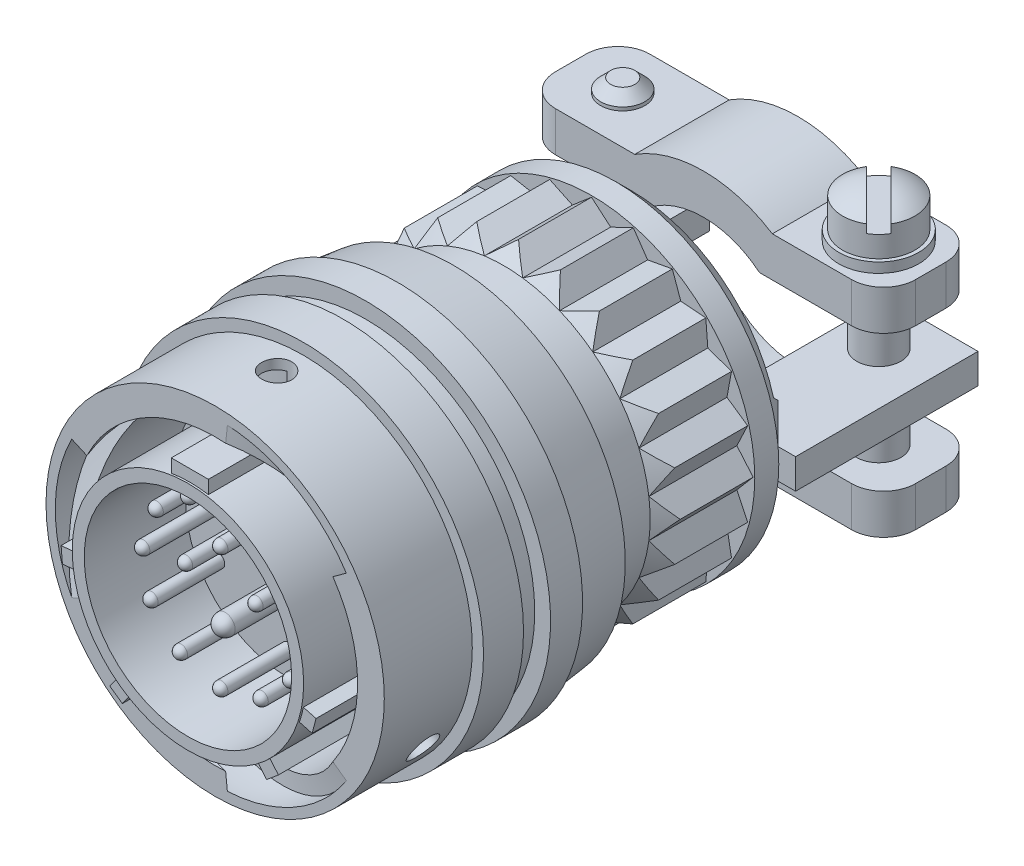
from build123d import *

# Parameters (mm, degrees)
SKETCH3_W                = 13.2842
SKETCH3_H                = 8.1407
BOSS_EXTRUDE1_START      = -9.2202
BOSS_EXTRUDE1_DEPTH      = 9.0678
SKETCH6_R                = 1.1938
CUT_EXTRUDE1_DEPTH       = 31.994286903
CUT_SWEEP1_PITCH         = 19.5072
CIRPATTERN1_COUNT        = 3
BOSS_EXTRUDE2_DEPTH      = 6.985
CIRPATTERN2_COUNT        = 24
BOSS_EXTRUDE3_DEPTH      = 13.208
BOSS_EXTRUDE3_DEPTH_BACK = 1.27
SKETCH12_W               = 7.2771
SKETCH12_H               = 2.3749
CHAMFER1_SIZE            = 1.905
CUT_EXTRUDE2_DEPTH       = 1.18745
CUT_EXTRUDE2_DEPTH_BACK  = 1.18745
SKETCH13_R               = 1.7526
BOSS_EXTRUDE4_DEPTH      = 7.493
SKETCH15_R               = 1.7526
CUT_EXTRUDE3_DEPTH       = 53.676709752
SKETCH16_W               = 1.2954
SKETCH16_H               = 0.7874
CUT_EXTRUDE4_START       = -1.6764
CUT_EXTRUDE4_DEPTH       = 55.345868243
CIRPATTERN3_COUNT        = 2
SKETCH14_15P_R           = 0.508
SKETCH14_15P_R_2         = 0.79375
BOSS_EXTRUDE14_15P_DEPTH = 5.7912
FILLET14_15P_20_R        = 0.508
FILLET14_15P_16_R        = 0.79375


with BuildPart() as part:
    # Sketch3 → Revolve1 (revolve)
    with BuildSketch(Plane(origin=(0, 0, 0), x_dir=(0, 0, -1), z_dir=(1, 0, 0)), mode=Mode.PRIVATE) as revolve1_sk:
        Polygon((9.7282, 10.2235), (9.7282, 9.525), (13.8684, 9.525), (14.66215, 10.31875), (20.44065, 10.31875), (21.2344, 9.525), (23.0124, 9.525), (23.0124, 9.3726), (21.2344, 9.3726), (21.2344, 8.2296), (0, 8.2296), (0, 9.1821), (9.2202, 9.1821), (9.2202, 10.2235), align=None)
        with Locations((14.5923, 4.07035)):
            Rectangle(SKETCH3_W, SKETCH3_H)
    revolve(revolve1_sk.sketch.rotate(Axis((0, 0, 0), (0, 0, -1)), 90), axis=Axis((0, 0, 0), (0, 0, -1)))

    # Sketch4 → Boss-Extrude1 (add)
    with BuildSketch(Plane.XY.offset(BOSS_EXTRUDE1_START)):
        with BuildLine():
            Line((-1.4732, 10.116799593), (1.4732, 10.116799593))
            Line((1.4732, 10.116799593), (1.4732, 9.063147476))
            ThreePointArc((1.4732, 9.063147476), (0, 9.1821), (-1.4732, 9.063147476))
            Line((-1.4732, 9.063147476), (-1.4732, 10.116799593))
        make_face()
        with BuildLine():
            Line((10.015348011, -2.052500052), (9.699795831, -3.230156819))
            Line((9.699795831, -3.230156819), (8.691883684, -2.960087573))
            ThreePointArc((8.691883684, -2.960087573), (8.86922753, -2.376502354), (9.007435863, -1.782430806))
            Line((9.007435863, -1.782430806), (10.015348011, -2.052500052))
        make_face()
        with BuildLine():
            Line((7.026827132, -7.425877235), (6.092865747, -8.209563888))
            Line((6.092865747, -8.209563888), (5.422137807, -7.410221455))
            ThreePointArc((5.422137807, -7.410221455), (5.902140111, -7.033896681), (6.356099192, -6.626534802))
            Line((6.356099192, -6.626534802), (7.026827132, -7.425877235))
        make_face()
        with BuildLine():
            Line((-5.354169915, -8.709352259), (-6.352880088, -8.010047868))
            Line((-6.352880088, -8.010047868), (-5.754371753, -7.155289382))
            ThreePointArc((-5.754371753, -7.155289382), (-5.266636196, -7.521535986), (-4.75566158, -7.854593773))
            Line((-4.75566158, -7.854593773), (-5.354169915, -8.709352259))
        make_face()
        with BuildLine():
            Line((-10.113344983, -1.496731609), (-10.219605264, -0.282171033))
            Line((-10.219605264, -0.282171033), (-9.180108534, -0.191226854))
            ThreePointArc((-9.180108534, -0.191226854), (-9.147159337, -0.800272745), (-9.073848253, -1.40578743))
            Line((-9.073848253, -1.40578743), (-10.113344983, -1.496731609))
        make_face()
    extrude(amount=BOSS_EXTRUDE1_DEPTH)

    # Sketch14-15P → Boss-Extrude14-15P (add)
    with BuildSketch(Plane.XY.offset(-7.9502)):
        with Locations(Location((2.54, 5.715, 0), (0, 0, 180))):
            Circle(SKETCH14_15P_R)
        with Locations(Location((5.1308, 3.556, 0), (0, 0, 180))):
            Circle(SKETCH14_15P_R)
        with Locations(Location((6.1976, 0.3556, 0), (0, 0, 180))):
            Circle(SKETCH14_15P_R)
        with Locations(Location((5.5372, -2.8702, 0), (0, 0, 180))):
            Circle(SKETCH14_15P_R)
        with Locations(Location((3.2004, -5.3086, 0), (0, 0, 180))):
            Circle(SKETCH14_15P_R)
        with Locations(Location((0, -6.223, 0), (0, 0, 180))):
            Circle(SKETCH14_15P_R)
        with Locations(Location((-3.2004, -5.3086, 0), (0, 0, 180))):
            Circle(SKETCH14_15P_R)
        with Locations(Location((-5.5372, -2.8702, 0), (0, 0, 180))):
            Circle(SKETCH14_15P_R)
        with Locations(Location((-6.1976, 0.3556, 0), (0, 0, 180))):
            Circle(SKETCH14_15P_R)
        with Locations(Location((-5.1308, 3.556, 0), (0, 0, 180))):
            Circle(SKETCH14_15P_R)
        with Locations(Location((-2.54, 5.715, 0), (0, 0, 180))):
            Circle(SKETCH14_15P_R)
        with Locations(Location((0, 3.556, 0), (0, 0, 180))):
            Circle(SKETCH14_15P_R)
        with Locations(Location((2.794, 1.016, 0), (0, 0, 180))):
            Circle(SKETCH14_15P_R)
        with Locations(Location((0, -1.9558, 0), (0, 0, 180))):
            Circle(SKETCH14_15P_R_2)
        with Locations(Location((-2.794, 1.016, 0), (0, 0, 180))):
            Circle(SKETCH14_15P_R)
    extrude(amount=BOSS_EXTRUDE14_15P_DEPTH)

    # Fillet14-15P-20
    fillet14_15p_20_edges = [part.edges().sort_by_distance(p)[0] for p in [
        (5.6388, 3.556, -2.159),
        (6.7056, 0.3556, -2.159),
        (6.0452, -2.8702, -2.159),
        (3.7084, -5.3086, -2.159),
        (0.508, -6.223, -2.159),
        (-2.6924, -5.3086, -2.159),
        (-5.0292, -2.8702, -2.159),
        (-5.6896, 0.3556, -2.159),
        (-4.6228, 3.556, -2.159),
        (-2.032, 5.715, -2.159),
        (0.508, 3.556, -2.159),
        (3.302, 1.016, -2.159),
        (-2.286, 1.016, -2.159),
        (3.048, 5.715, -2.159),
    ]]
    fillet(fillet14_15p_20_edges, radius=FILLET14_15P_20_R)

    # Fillet14-15P-16
    fillet14_15p_16_edges = [part.edges().sort_by_distance(p)[0] for p in [
        (0.79375, -1.9558, -2.159),
    ]]
    fillet(fillet14_15p_16_edges, radius=FILLET14_15P_16_R)


with BuildPart() as body_2:
    # Sketch5 → Revolve2 (revolve)
    with BuildSketch(Plane(origin=(0, 0, 0), x_dir=(0, 0, -1), z_dir=(1, 0, 0)), mode=Mode.PRIVATE) as revolve2_sk:
        Polygon((2.159, 13.4239), (2.159, 11.303), (17.272, 11.303), (17.272, 13.1826), (21.082, 13.1826), (21.082, 13.6271), (16.637, 14.172877373), (16.637, 14.6812), (14.097, 14.6812), (14.097, 13.4239), (12.319, 13.4239), (12.319, 14.3129), (9.144, 14.3129), (9.144, 13.4239), align=None)
    revolve(revolve2_sk.sketch.rotate(Axis((0, 0, -23.0124), (0, 0, 1)), 90), axis=Axis((0, 0, -23.0124), (0, 0, 1)))

    # Sketch6 → Cut-Extrude1 (cut, through all)
    with BuildSketch(Plane(origin=(0, 0, 0), x_dir=(1, 0, 0), z_dir=(0, 1, 0))):
        with Locations(Location((0, 7.0358, 0), (0, 0, 90))):
            Circle(SKETCH6_R)
    cut_extrude1 = extrude(amount=CUT_EXTRUDE1_DEPTH, mode=Mode.SUBTRACT)

    # Cut-Sweep1: arcs per turn and ends read off the stored shape
    # Cut-Sweep1: the profile of Sketch8 screwed along a right-hand helix through 1.25 turns, 20 arcs to a turn; built about Z, then put on its axis
    cut_sweep1_z = Axis((0, 0, 0), (0, 0, 1))
    cut_sweep1_corners = [(11.222546706, 0.356563099, -20.80532064), (12.614518038, 0.356563099, -20.80532064), (12.614518038, -0.356563099, -18.20907936), (11.222546706, -0.356563099, -18.20907936)]
    with BuildLine(mode=Mode.PRIVATE) as cut_sweep1_profile:
        Line(cut_sweep1_corners[0], cut_sweep1_corners[1])
        Line(cut_sweep1_corners[2], cut_sweep1_corners[3])
        ThreePointArc((12.614518038, 0.356563099, -20.80532064), (12.686146766, 0, -19.5072), (12.614518038, -0.356563099, -18.20907936))
        ThreePointArc((11.222546706, -0.356563099, -18.20907936), (11.303, 0, -19.5072), (11.222546706, 0.356563099, -20.80532064))
    cut_sweep1_cap = Face(cut_sweep1_profile.wire())
    cut_sweep1_arcs = [((12.614518038, 0.356563099, -20.80532064), (12.758182222, 0, -19.5072), (12.614518038, -0.356563099, -18.20907936), (1, 0.9943537837433927, 1)), ((11.222546706, -0.356563099, -18.20907936), (11.384030056, 0, -19.5072), (11.222546706, 0.356563099, -20.80532064), (1, 0.992882129136328, 1))]  # start, shoulder, end, weights
    cut_sweep1_turn_angles = [0, 9, 18, 27, 36, 45, 54, 63, 72, 81, 90, 99, 108, 117, 126, 135, 144, 153, 162, 171, 180, 189, 198, 207, 216, 225, 234, 243, 252, 261, 270, 279, 288, 297, 306, 315, 324, 333, 342, 351, 360]
    cut_sweep1_turn_weights = [1, 0.9876883405951378, 1, 0.9876883405951378, 1, 0.9876883405951378, 1, 0.9876883405951378, 1, 0.9876883405951378, 1, 0.9876883405951378, 1, 0.9876883405951378, 1, 0.9876883405951378, 1, 0.9876883405951378, 1, 0.9876883405951378, 1, 0.9876883405951378, 1, 0.9876883405951378, 1, 0.9876883405951378, 1, 0.9876883405951378, 1, 0.9876883405951378, 1, 0.9876883405951378, 1, 0.9876883405951378, 1, 0.9876883405951378, 1, 0.9876883405951378, 1, 0.9876883405951378, 1]
    cut_sweep1_turn_rails = [Edge.make_bspline([Vector(p[0], p[1], 0).rotate(cut_sweep1_z, cut_sweep1_turn_angles[k]) / cut_sweep1_turn_weights[k] + Vector(0, 0, p[2] + CUT_SWEEP1_PITCH * cut_sweep1_turn_angles[k] / 360) for k in range(41)], [0, 0, 0, 1, 1, 2, 2, 3, 3, 4, 4, 5, 5, 6, 6, 7, 7, 8, 8, 9, 9, 10, 10, 11, 11, 12, 12, 13, 13, 14, 14, 15, 15, 16, 16, 17, 17, 18, 18, 19, 19, 20, 20, 20], 2, cut_sweep1_turn_weights) for p in cut_sweep1_corners]
    cut_sweep1_turn_sides = [*[Face.make_surface_from_curves(cut_sweep1_turn_rails[p[0]], cut_sweep1_turn_rails[p[1]]) for p in [(0, 1), (2, 3)]], *[Face.make_bezier_surface([[Vector(p[j][0], p[j][1], 0).rotate(cut_sweep1_z, cut_sweep1_turn_angles[2 * i + k]) / cut_sweep1_turn_weights[2 * i + k] + Vector(0, 0, p[j][2] + CUT_SWEEP1_PITCH * cut_sweep1_turn_angles[2 * i + k] / 360) for k in range(3)] for j in range(3)], [[p[3][j] * cut_sweep1_turn_weights[2 * i + k] for k in range(3)] for j in range(3)]) for p in cut_sweep1_arcs for i in range(20)]]
    cut_sweep1_last_angles = [360, 369, 378, 387, 396, 405, 414, 423, 432, 441, 450]
    cut_sweep1_last_weights = [1, 0.9876883405951378, 1, 0.9876883405951378, 1, 0.9876883405951378, 1, 0.9876883405951378, 1, 0.9876883405951378, 1]
    cut_sweep1_last_rails = [Edge.make_bspline([Vector(p[0], p[1], 0).rotate(cut_sweep1_z, cut_sweep1_last_angles[k]) / cut_sweep1_last_weights[k] + Vector(0, 0, p[2] + CUT_SWEEP1_PITCH * cut_sweep1_last_angles[k] / 360) for k in range(11)], [0, 0, 0, 1, 1, 2, 2, 3, 3, 4, 4, 5, 5, 5], 2, cut_sweep1_last_weights) for p in cut_sweep1_corners]
    cut_sweep1_last_sides = [*[Face.make_surface_from_curves(cut_sweep1_last_rails[p[0]], cut_sweep1_last_rails[p[1]]) for p in [(0, 1), (2, 3)]], *[Face.make_bezier_surface([[Vector(p[j][0], p[j][1], 0).rotate(cut_sweep1_z, cut_sweep1_last_angles[2 * i + k]) / cut_sweep1_last_weights[2 * i + k] + Vector(0, 0, p[j][2] + CUT_SWEEP1_PITCH * cut_sweep1_last_angles[2 * i + k] / 360) for k in range(3)] for j in range(3)], [[p[3][j] * cut_sweep1_last_weights[2 * i + k] for k in range(3)] for j in range(3)]) for p in cut_sweep1_arcs for i in range(5)]]
    cut_sweep1 = Plane(origin=(0, 0, -2.159), x_dir=(-1, 0, 0), z_dir=(0, 0, -1)) * Solid(Shell([*cut_sweep1_turn_sides, *cut_sweep1_last_sides, cut_sweep1_cap, cut_sweep1_cap.rotate(cut_sweep1_z, 450).moved(Location((0, 0, CUT_SWEEP1_PITCH * 450 / 360)))]))
    add(cut_sweep1, mode=Mode.SUBTRACT)

    # CirPattern1: Cut-Extrude1, Cut-Sweep1 ×3 about axis
    cirpattern1_axis = Axis((0, 0, -23.0124), (0, 0, -1))
    add([cut_extrude1.rotate(cirpattern1_axis, i * 360 / CIRPATTERN1_COUNT) for i in range(1, CIRPATTERN1_COUNT)], mode=Mode.SUBTRACT)
    add([cut_sweep1.rotate(cirpattern1_axis, i * 360 / CIRPATTERN1_COUNT) for i in range(1, CIRPATTERN1_COUNT)], mode=Mode.SUBTRACT)


with BuildPart() as body_3:
    # Sketch9 → Revolve3 (revolve)
    with BuildSketch(Plane(origin=(0, 0, 0), x_dir=(0, 0, -1), z_dir=(1, 0, 0)), mode=Mode.PRIVATE) as revolve3_sk:
        Polygon((18.3134, 11.6332), (18.3134, 10.31875), (32.0294, 10.31875), (32.0294, 7.0104), (35.2044, 7.0104), (35.2044, 11.684), (33.9344, 12.954), (32.0294, 12.954), (32.0294, 11.6332), align=None)
    revolve(revolve3_sk.sketch.rotate(Axis((0, 0, 0), (0, 0, -1)), 90), axis=Axis((0, 0, 0), (0, 0, -1)))

    # Sketch10 → Boss-Extrude2 (add)
    with BuildSketch(Plane.XY.offset(-32.0294)):
        with BuildLine():
            Line((-1.518437299, 11.533676361), (0, 12.827))
            Line((0, 12.827), (1.518437299, 11.533676361))
            ThreePointArc((1.518437299, 11.533676361), (0, 11.6332), (-1.518437299, 11.533676361))
        make_face()
    boss_extrude2 = extrude(amount=BOSS_EXTRUDE2_DEPTH)

    # CirPattern2: Boss-Extrude2 ×24 about axis
    cirpattern2_axis = Axis((0, 0, 0), (0, 0, 1))
    for i in range(1, CIRPATTERN2_COUNT):
        add(boss_extrude2.rotate(cirpattern2_axis, i * 360 / CIRPATTERN2_COUNT))

    # Sketch11 → Cut-Revolve1 (revolve, cut)
    with BuildSketch(Plane(origin=(0, 0, 0), x_dir=(0, 0, -1), z_dir=(1, 0, 0))):
        Polygon((25.0444, 12.827), (25.0444, 11.6332), (26.2382, 12.827), align=None)
    revolve(axis=Axis((0, 0, -32.0294), (0, 0, 1)), mode=Mode.SUBTRACT)

    # Sketch12 → Boss-Extrude3 (add, two sides: drawn at the far end of the back side and taken through both)
    with BuildSketch(Plane(origin=(0, 0, -35.2044), x_dir=(-1, 0, 0), z_dir=(0, 0, -1)).offset(-BOSS_EXTRUDE3_DEPTH_BACK)):
        with Locations((-10.64895, 0)):
            Rectangle(SKETCH12_W, SKETCH12_H)
        with Locations((10.64895, 0)):
            Rectangle(SKETCH12_W, SKETCH12_H)
    extrude(amount=BOSS_EXTRUDE3_DEPTH + BOSS_EXTRUDE3_DEPTH_BACK)

    # Chamfer1
    chamfer1_edges = [body_3.edges().sort_by_distance(p)[0] for p in [
        (9.316951425, 1.18745, -35.2044),
        (9.316951425, -1.18745, -35.2044),
        (-9.316951425, -1.18745, -35.2044),
        (-9.316951425, 1.18745, -35.2044),
    ]]
    chamfer(chamfer1_edges, length=CHAMFER1_SIZE)

    # Sketch13 → Cut-Extrude2 (cut, two sides: drawn at the far end of the back side and taken through both)
    with BuildSketch(Plane(origin=(0, 0, 0), x_dir=(1, 0, 0), z_dir=(0, 1, 0)).offset(-CUT_EXTRUDE2_DEPTH_BACK)):
        with Locations((10.16, 44.6659)):
            Circle(SKETCH13_R)
        with Locations((-10.16, 44.6659)):
            Circle(SKETCH13_R)
    extrude(amount=CUT_EXTRUDE2_DEPTH + CUT_EXTRUDE2_DEPTH_BACK, mode=Mode.SUBTRACT)


with BuildPart() as body_4:
    # Sketch14 → Boss-Extrude4 (new body)
    with BuildSketch(Plane(origin=(0, 0, -48.4124), x_dir=(-1, 0, 0), z_dir=(0, 0, -1))):
        with BuildLine():
            Line((-14.2875, 5.4229), (-14.2875, 8.5979))
            Line((-14.2875, 8.5979), (-5.460630801, 8.5979))
            ThreePointArc((-5.460630801, 8.5979), (0, 10.1854), (5.460630801, 8.5979))
            Line((5.460630801, 8.5979), (14.2875, 8.5979))
            Line((14.2875, 8.5979), (14.2875, 5.4229))
            Line((14.2875, 5.4229), (4.442731564, 5.4229))
            ThreePointArc((4.442731564, 5.4229), (0, 7.0104), (-4.442731564, 5.4229))
            Line((-4.442731564, 5.4229), (-14.2875, 5.4229))
        make_face()
    extrude(amount=-BOSS_EXTRUDE4_DEPTH)

    # Sketch15 → Cut-Extrude3 (cut, through all)
    with BuildSketch(Plane(origin=(0, 0, 0), x_dir=(1, 0, 0), z_dir=(0, 1, 0))):
        with Locations((-10.16, 44.6659)):
            Circle(SKETCH15_R)
        with Locations((10.16, 44.6659)):
            Circle(SKETCH15_R)
        with BuildLine():
            Line((11.7475, 48.4124), (14.2875, 48.4124))
            Line((14.2875, 48.4124), (14.2875, 45.8724))
            ThreePointArc((14.2875, 45.8724), (13.543551224, 47.668451224), (11.7475, 48.4124))
        make_face()
        with BuildLine():
            Line((14.2875, 40.9194), (11.7475, 40.9194))
            ThreePointArc((11.7475, 40.9194), (13.543551224, 41.663348776), (14.2875, 43.4594))
            Line((14.2875, 43.4594), (14.2875, 40.9194))
        make_face()
        with BuildLine():
            Line((-14.2875, 48.4124), (-11.7475, 48.4124))
            ThreePointArc((-11.7475, 48.4124), (-13.543551224, 47.668451224), (-14.2875, 45.8724))
            Line((-14.2875, 45.8724), (-14.2875, 48.4124))
        make_face()
        with BuildLine():
            Line((-11.7475, 40.9194), (-14.2875, 40.9194))
            Line((-14.2875, 40.9194), (-14.2875, 43.4594))
            ThreePointArc((-14.2875, 43.4594), (-13.543551224, 41.663348776), (-11.7475, 40.9194))
        make_face()
    extrude(amount=CUT_EXTRUDE3_DEPTH, mode=Mode.SUBTRACT)


with BuildPart() as body_5:
    # Sketch16 → Revolve4 (revolve)
    with BuildSketch(Plane.XY.offset(-44.6659), mode=Mode.PRIVATE) as revolve4_sk:
        with Locations((7.6327, 8.9916)):
            Rectangle(SKETCH16_W, SKETCH16_H)
    revolve(revolve4_sk.sketch.rotate(Axis((10.16, 0, -44.6659), (0, 1, 0)), 270), axis=Axis((10.16, 0, -44.6659), (0, 1, 0)))


with BuildPart() as body_6:
    # Sketch17 → Revolve5 (revolve)
    with BuildSketch(Plane.XY.offset(-44.6659), mode=Mode.PRIVATE) as revolve5_sk:
        with BuildLine():
            Line((10.16, 12.7381), (10.16, -9.6647))
            Line((10.16, -9.6647), (9.20115, -9.6647))
            Line((9.20115, -9.6647), (8.4074, -8.87095))
            Line((8.4074, -8.87095), (8.4074, 9.3853))
            Line((8.4074, 9.3853), (7.2898, 9.3853))
            Line((7.2898, 9.3853), (7.2898, 11.73226))
            ThreePointArc((7.2898, 11.73226), (8.639328919, 12.479360105), (10.16, 12.7381))
        make_face()
    revolve(revolve5_sk.sketch.rotate(Axis((10.16, 9.3853, -44.6659), (0, -1, 0)), 270), axis=Axis((10.16, 9.3853, -44.6659), (0, -1, 0)))

    # Sketch18 → Cut-Extrude4 (cut, through all)
    with BuildSketch(Plane.XZ.offset(-9.3853).offset(CUT_EXTRUDE4_START)):
        Polygon((7.63935436, -46.204330127), (8.621569873, -47.18654564), (12.68064564, -43.127469873), (11.698430127, -42.14525436), align=None)
    extrude(amount=-CUT_EXTRUDE4_DEPTH, mode=Mode.SUBTRACT)


with BuildPart() as cirpattern3_1:
    # CirPattern3: pattern copy
    add(body_4.part.rotate(Axis((0, 0, 0), (0, 0, 1)), 1 * 360 / CIRPATTERN3_COUNT))


with BuildPart() as cirpattern3_2:
    # CirPattern3: pattern copy
    add(body_6.part.rotate(Axis((0, 0, 0), (0, 0, 1)), 1 * 360 / CIRPATTERN3_COUNT))


with BuildPart() as cirpattern3_3:
    # CirPattern3: pattern copy
    add(body_5.part.rotate(Axis((0, 0, 0), (0, 0, 1)), 1 * 360 / CIRPATTERN3_COUNT))


solid = Compound([part.part, body_2.part, body_3.part, body_4.part, body_5.part, body_6.part, cirpattern3_1.part, cirpattern3_2.part, cirpattern3_3.part])
